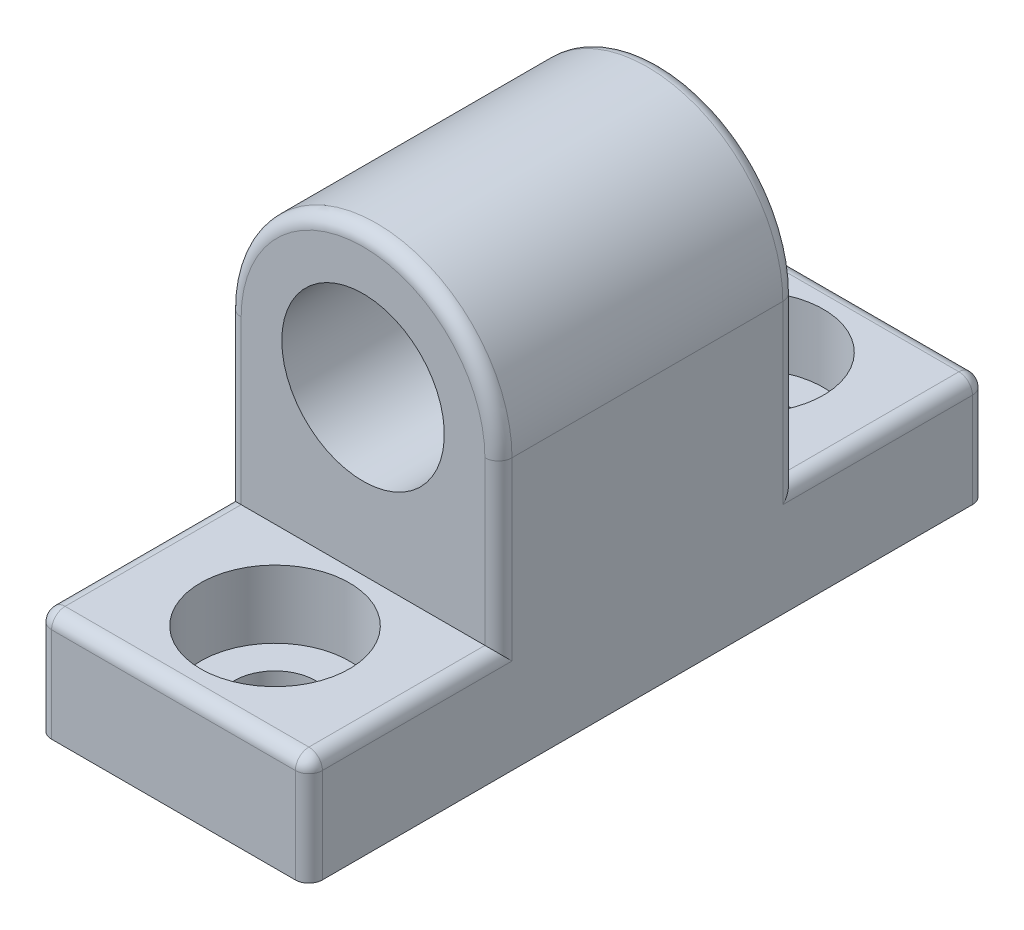
from build123d import *

# Parameters (mm, degrees)
SKETCH_1_R               = 6
EXTRUDE_1_DEPTH          = 25
CUT_EXTRUDE_1_DEPTH      = 41.311288741
CUT_EXTRUDE_1_DEPTH_BACK = 41.311288741
SKETCH_2_W               = 21.902921801
SKETCH_2_H               = 31.191688498
SKETCH_2_W_2             = 23.513880173
SKETCH_2_H_2             = 33.775615356
CUT_EXTRUDE_2_REACH      = 45.875
SKETCH_3_R               = 2.5
SKETCH_4_R               = 3
CUT_EXTRUDE_3_DEPTH      = 12
SKETCH_5_R               = 5.5
CUT_EXTRUDE_4_DEPTH      = 5
SKETCH_6_R               = 3
CUT_EXTRUDE_5_DEPTH      = 39.131352027
FILLET_1_R               = 1


with BuildPart() as part:
    # Эскиз1 → Бобышка-Вытянуть1 (new, symmetric)
    with BuildSketch(Plane.XY):
        with BuildLine():
            Line((-10, 0), (10, 0))
            Line((10, 0), (10, 20))
            ThreePointArc((10, 20), (0, 30), (-10, 20))
            Line((-10, 20), (-10, 0))
        make_face()
        with Locations((0, 20)):
            Circle(SKETCH_1_R, mode=Mode.SUBTRACT)
    extrude(amount=EXTRUDE_1_DEPTH, both=True)

    # Эскиз2 → Вырез-Вытянуть1 (cut, two sides: drawn at the far end of the back side and taken through both)
    with BuildSketch(Plane(origin=(0, 0, 0), x_dir=(0, 0, -1), z_dir=(1, 0, 0)).offset(-CUT_EXTRUDE_1_DEPTH_BACK)):
        with Locations((21.951460901, 23.595844249)):
            Rectangle(SKETCH_2_W, SKETCH_2_H)
        with Locations((-22.756940087, 24.887807678)):
            Rectangle(SKETCH_2_W_2, SKETCH_2_H_2)
    extrude(amount=CUT_EXTRUDE_1_DEPTH + CUT_EXTRUDE_1_DEPTH_BACK, mode=Mode.SUBTRACT)

    # Эскиз3 → Вырез-Вытянуть2 (cut, up to next)
    with BuildSketch(Plane.ZY.offset(10), mode=Mode.PRIVATE) as cut_extrude_2_sk1:
        with Locations((0, 20)):
            Circle(SKETCH_3_R)
    cut_extrude_2_tool1 = extrude(cut_extrude_2_sk1.sketch, amount=-CUT_EXTRUDE_2_REACH, mode=Mode.PRIVATE) & part.part
    add(cut_extrude_2_tool1.solids().sort_by_distance((-10, 20, 0))[0], mode=Mode.SUBTRACT)

    # Эскиз4 → Вырез-Вытянуть3 (cut)
    with BuildSketch(Plane(origin=(0, 0, 0), x_dir=(-1, 0, 0), z_dir=(0, -1, 0))):
        Circle(SKETCH_4_R)
    extrude(amount=-CUT_EXTRUDE_3_DEPTH, mode=Mode.SUBTRACT)

    # Эскиз5 → Вырез-Вытянуть4 (cut)
    with BuildSketch(Plane(origin=(0, 8, 0), x_dir=(1, 0, 0), z_dir=(0, 1, 0))):
        with Locations((0, 17.5)):
            Circle(SKETCH_5_R)
        with Locations((0, -17.5)):
            Circle(SKETCH_5_R)
    extrude(amount=-CUT_EXTRUDE_4_DEPTH, mode=Mode.SUBTRACT)

    # Эскиз6 → Вырез-Вытянуть5 (cut, through all)
    with BuildSketch(Plane(origin=(0, 3, 0), x_dir=(1, 0, 0), z_dir=(0, 1, 0))):
        with Locations((0, 17.5)):
            Circle(SKETCH_6_R)
        with Locations((0, -17.5)):
            Circle(SKETCH_6_R)
    extrude(amount=-CUT_EXTRUDE_5_DEPTH, mode=Mode.SUBTRACT)

    # Скругление1
    fillet_1_edges = [part.edges().sort_by_distance(p)[0] for p in [
        (10, 14, 11),
        (10, 14, -11),
        (10, 8, -18),
        (10, 4, 25),
        (-10, 4, 25),
        (-10, 8, 18),
        (0, 8, 25),
        (10, 8, 18),
        (0, 30, 11),
        (-10, 14, 11),
        (-10, 14, -11),
        (0, 30, -11),
        (-10, 4, -25),
        (0, 8, -25),
        (-10, 8, -18),
        (10, 4, -25),
    ]]
    fillet(fillet_1_edges, radius=FILLET_1_R)


solid = part.part
